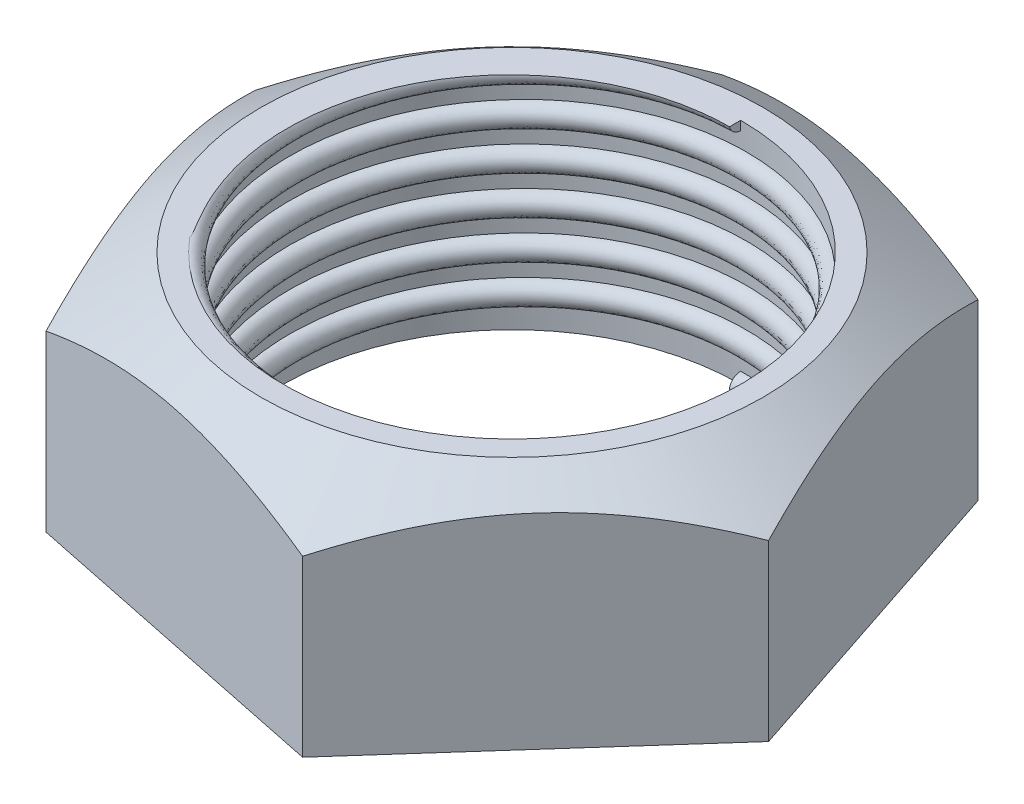
from build123d import *

# Parameters (mm, degrees)
SKETCH1_R               = 12.7
BOSS_EXTRUDE1_DEPTH     = 12.7
SWEEP1_PITCH            = 2.14
CUT_EXTRUDE2_DEPTH      = 29.401060586
CUT_EXTRUDE2_DEPTH_BACK = 29.401060586
SKETCH7_W               = 27.888681782
SKETCH7_H               = 3.81


with BuildPart() as part:
    # Sketch1 → Boss-Extrude1 (new body)
    with BuildSketch(Plane(origin=(0, 0, 0), x_dir=(1, 0, 0), z_dir=(0, 1, 0))):
        Polygon((5.76874625, -17.399494247), (17.952777155, -3.703866323), (12.184030906, 13.695627924), (-5.76874625, 17.399494247), (-17.952777155, 3.703866323), (-12.184030906, -13.695627924), align=None)
        with Locations(Location((0, 0, 0), (0, 0, 270))):
            Circle(SKETCH1_R, mode=Mode.SUBTRACT)
    extrude(amount=BOSS_EXTRUDE1_DEPTH)

    # Sketch2 → Cut-Revolve1 (revolve, cut)
    with BuildSketch(Plane.XY, mode=Mode.PRIVATE) as cut_revolve1_sk:
        Polygon((13.944340891, 12.7), (19.167569917, 9.088853569), (21.628703, 12.7), align=None)
    revolve(cut_revolve1_sk.sketch.rotate(Axis((0, 0, 0), (0, 1, 0)), 90), axis=Axis((0, 0, 0), (0, 1, 0)), mode=Mode.SUBTRACT)

    # Sweep1: the profile of Sketch5 screwed along a left-hand helix of 6 turns, 10 arcs to a turn; built about Z, then put on its axis
    sweep1_z = Axis((0, 0, 0), (0, 0, 1))
    sweep1_corners = [(13.335, 0, 0), (12.7, 0, 0.635), (12.065, 0, 0), (12.7, 0, -0.635)]
    with BuildLine(mode=Mode.PRIVATE) as sweep1_profile:
        ThreePointArc((13.335, 0, 0), (13.149012806, 0, 0.449012806), (12.7, 0, 0.635))
        ThreePointArc((12.7, 0, 0.635), (12.250987194, 0, 0.449012806), (12.065, 0, 0))
        ThreePointArc((12.065, 0, 0), (12.250987194, 0, -0.449012806), (12.7, 0, -0.635))
        ThreePointArc((12.7, 0, -0.635), (13.149012806, 0, -0.449012806), (13.335, 0, 0))
    sweep1_cap = Face(sweep1_profile.wire())
    sweep1_arcs = [((13.335, 0, 0), (13.335, 0, 0.635), (12.7, 0, 0.635), (1, 0.7071067811865476, 1)), ((12.7, 0, 0.635), (12.065, 0, 0.635), (12.065, 0, 0), (1, 0.7071067811865476, 1)), ((12.065, 0, 0), (12.065, 0, -0.635), (12.7, 0, -0.635), (1, 0.7071067811865476, 1)), ((12.7, 0, -0.635), (13.335, 0, -0.635), (13.335, 0, 0), (1, 0.7071067811865476, 1))]  # start, shoulder, end, weights
    sweep1_turn_angles = [0, -18, -36, -54, -72, -90, -108, -126, -144, -162, -180, -198, -216, -234, -252, -270, -288, -306, -324, -342, -360]
    sweep1_turn_weights = [1, 0.9510565162951535, 1, 0.9510565162951535, 1, 0.9510565162951535, 1, 0.9510565162951535, 1, 0.9510565162951535, 1, 0.9510565162951535, 1, 0.9510565162951535, 1, 0.9510565162951535, 1, 0.9510565162951535, 1, 0.9510565162951535, 1]
    sweep1_turn_sides = [Face.make_bezier_surface([[Vector(p[j][0], p[j][1], 0).rotate(sweep1_z, sweep1_turn_angles[2 * i + k]) / sweep1_turn_weights[2 * i + k] + Vector(0, 0, p[j][2] + -SWEEP1_PITCH * sweep1_turn_angles[2 * i + k] / 360) for k in range(3)] for j in range(3)], [[p[3][j] * sweep1_turn_weights[2 * i + k] for k in range(3)] for j in range(3)]) for p in sweep1_arcs for i in range(10)]
    sweep1 = Plane(origin=(0, 0, 0), x_dir=(0, 0, -1), z_dir=(0, 1, 0)) * Solid(Shell([*[p.moved(Location((0, 0, SWEEP1_PITCH * i))) for i in range(6) for p in sweep1_turn_sides], sweep1_cap, sweep1_cap.rotate(sweep1_z, -2160).moved(Location((0, 0, -SWEEP1_PITCH * -2160 / 360)))]))
    add(sweep1)

    # Sketch7 → Cut-Extrude2 (cut, two sides: drawn at the far end of the back side and taken through both)
    with BuildSketch(Plane.XY.offset(-CUT_EXTRUDE2_DEPTH_BACK)):
        with Locations((0, 14.605)):
            Rectangle(SKETCH7_W, SKETCH7_H)
        with Locations((0, -1.905)):
            Rectangle(SKETCH7_W, SKETCH7_H)
    extrude(amount=CUT_EXTRUDE2_DEPTH + CUT_EXTRUDE2_DEPTH_BACK, mode=Mode.SUBTRACT)


solid = part.part
